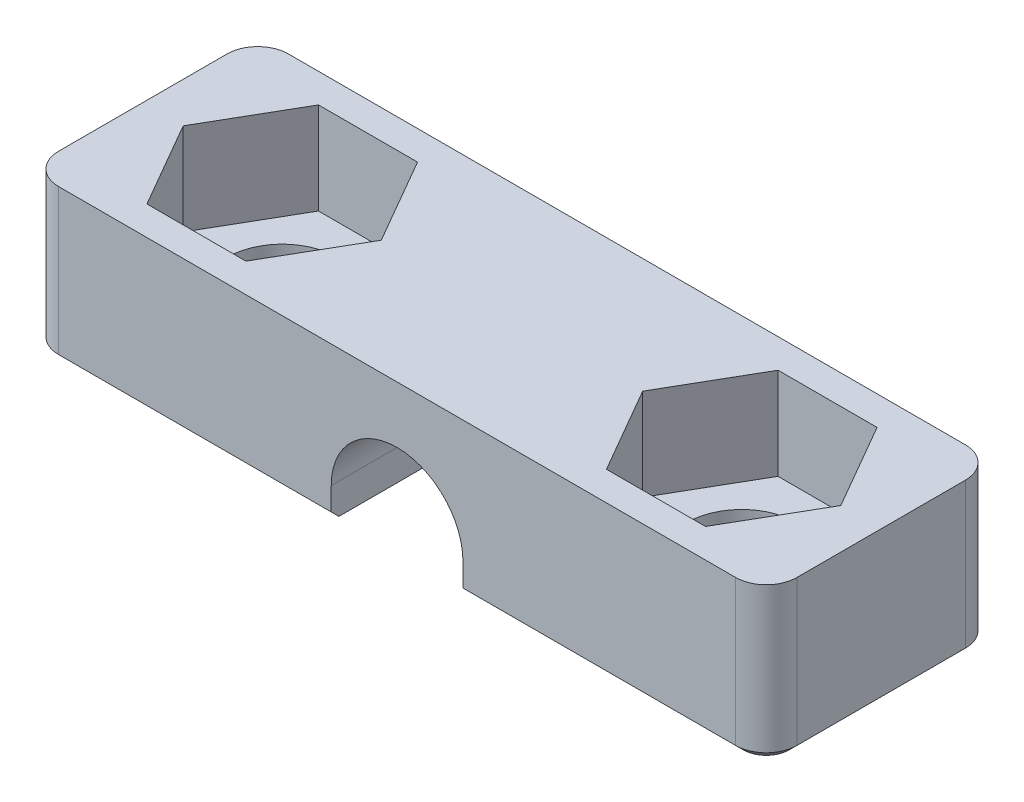
from build123d import *

# Parameters (mm, degrees)
EXTRUDE1_DEPTH = 7.5
SKETCH2_R      = 1.8
EXTRUDE2_DEPTH = 16.047835964
SKETCH_R       = 1.8
EXTRUDE3_DEPTH = 3
FILLET1_R      = 1
CHAMFER1_SIZE  = 0.25


with BuildPart() as part:
    # Sketch1 → Extrude1 (new body)
    with BuildSketch(Plane.XY):
        with BuildLine():
            Line((-2.15, 0), (-2.15, 1))
            ThreePointArc((-2.15, 1), (0, 3.15), (2.15, 1))
            Line((2.15, 1), (2.15, 0))
            Line((2.15, 0), (12.049372067, 0))
            Line((12.049372067, 0), (12.049372067, 5))
            Line((12.049372067, 5), (-12.049372067, 5))
            Line((-12.049372067, 5), (-12.049372067, 0))
            Line((-12.049372067, 0), (-2.15, 0))
        make_face()
    extrude(amount=EXTRUDE1_DEPTH)

    # Sketch2 → Extrude2 (cut, through all)
    with BuildSketch(Plane(origin=(0, 5, 0), x_dir=(1, 0, 0), z_dir=(0, 1, 0))):
        with Locations((7.5, -3.75)):
            Circle(SKETCH2_R)
        with Locations((-7.5, -3.75)):
            Circle(SKETCH2_R)
    extrude(amount=-EXTRUDE2_DEPTH, mode=Mode.SUBTRACT)

    # Sketch → Extrude3 (cut)
    # profile 1 of 2: a face of its own
    with BuildSketch(Plane(origin=(0, 5, 0), x_dir=(1, 0, 0), z_dir=(0, 1, 0))):
        Polygon((-9.116580754, -6.55), (-10.733161507, -3.75), (-9.116580754, -0.95), (-5.883419246, -0.95), (-4.266838493, -3.75), (-5.883419246, -6.55), align=None)
        with Locations((-7.5, -3.75)):
            Circle(SKETCH_R, mode=Mode.SUBTRACT)
    # profile 2 of 2: a face of its own
    with BuildSketch(Plane(origin=(0, 5, 0), x_dir=(1, 0, 0), z_dir=(0, 1, 0))):
        Polygon((10.733161507, -3.75), (9.116580754, -0.95), (5.883419246, -0.95), (4.266838493, -3.75), (5.883419246, -6.55), (9.116580754, -6.55), align=None)
        with Locations((7.5, -3.75)):
            Circle(SKETCH_R, mode=Mode.SUBTRACT)
    extrude(amount=-EXTRUDE3_DEPTH, mode=Mode.SUBTRACT)

    # Fillet1
    fillet1_edges = [part.edges().sort_by_distance(p)[0] for p in [
        (12.049372067, 2.5, 0),
        (12.049372067, 2.5, 7.5),
        (-12.049372067, 2.5, 0),
        (-12.049372067, 2.5, 7.5),
    ]]
    fillet(fillet1_edges, radius=FILLET1_R)

    # Chamfer1
    chamfer1_edges = [part.edges().sort_by_distance(p)[0] for p in [
        (-9.3, 0, 3.75),
        (5.7, 0, 3.75),
        (6.599686034, 0, 0),
        (11.756478848, 0, 0.292893219),
        (12.049372067, 0, 3.75),
        (11.756478848, 0, 7.207106781),
        (6.599686034, 0, 7.5),
        (-6.599686034, 0, 0),
        (-11.756478848, 0, 0.292893219),
        (-12.049372067, 0, 3.75),
        (-11.756478848, 0, 7.207106781),
        (-6.599686034, 0, 7.5),
    ]]
    chamfer(chamfer1_edges, length=CHAMFER1_SIZE)


solid = part.part
